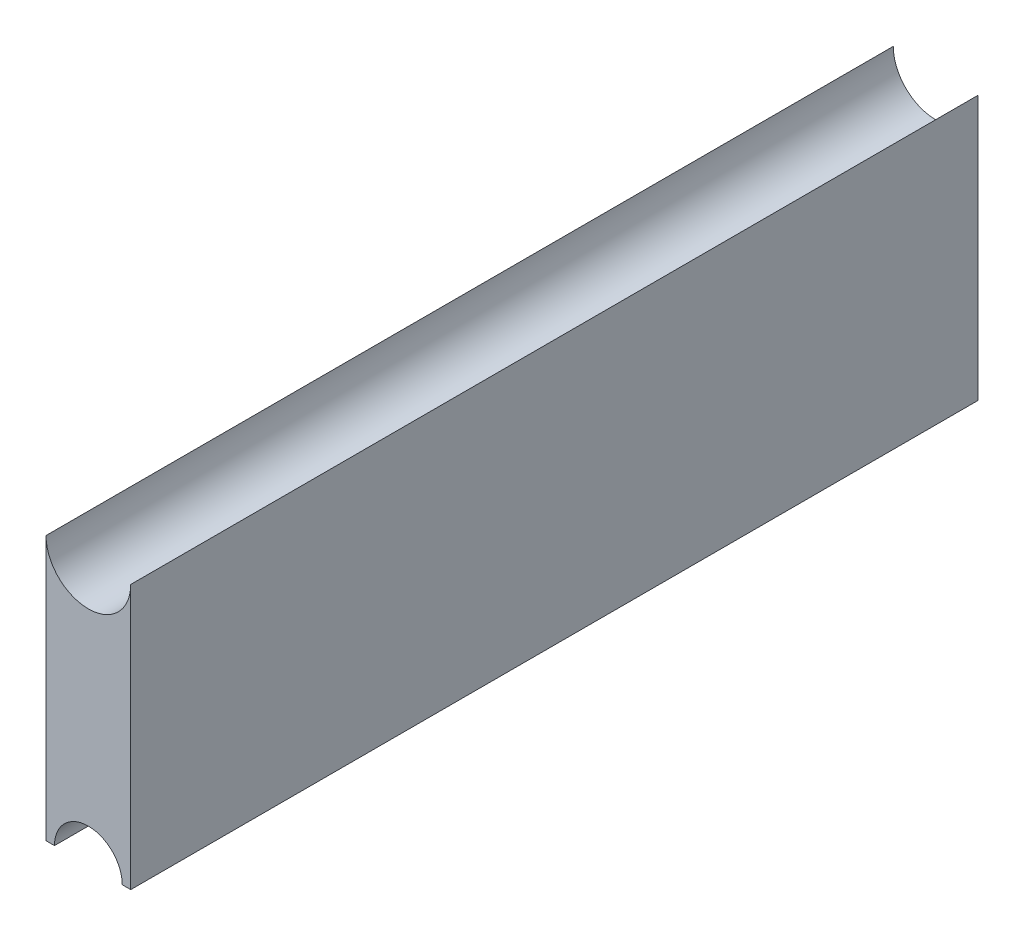
from build123d import *

# Parameters (mm, degrees)
BOSS_EXTRUDE4_DEPTH = 63.5


with BuildPart() as part:
    # Sketch1 → Boss-Extrude4 (new body)
    with BuildSketch(Plane.XY):
        with BuildLine():
            Line((-5.207, -28.192200533), (-5.207, -8.382))
            ThreePointArc((-5.207, -8.382), (-8.382, -11.557), (-11.557, -8.382))
            Line((-11.557, -8.382), (-11.557, -28.192200533))
            Line((-11.557, -28.192200533), (-10.921999363, -28.192200533))
            ThreePointArc((-10.921999363, -28.192200533), (-8.382, -25.654), (-5.842000637, -28.192200533))
            Line((-5.842000637, -28.192200533), (-5.207, -28.192200533))
        make_face()
    extrude(amount=BOSS_EXTRUDE4_DEPTH)


solid = part.part
